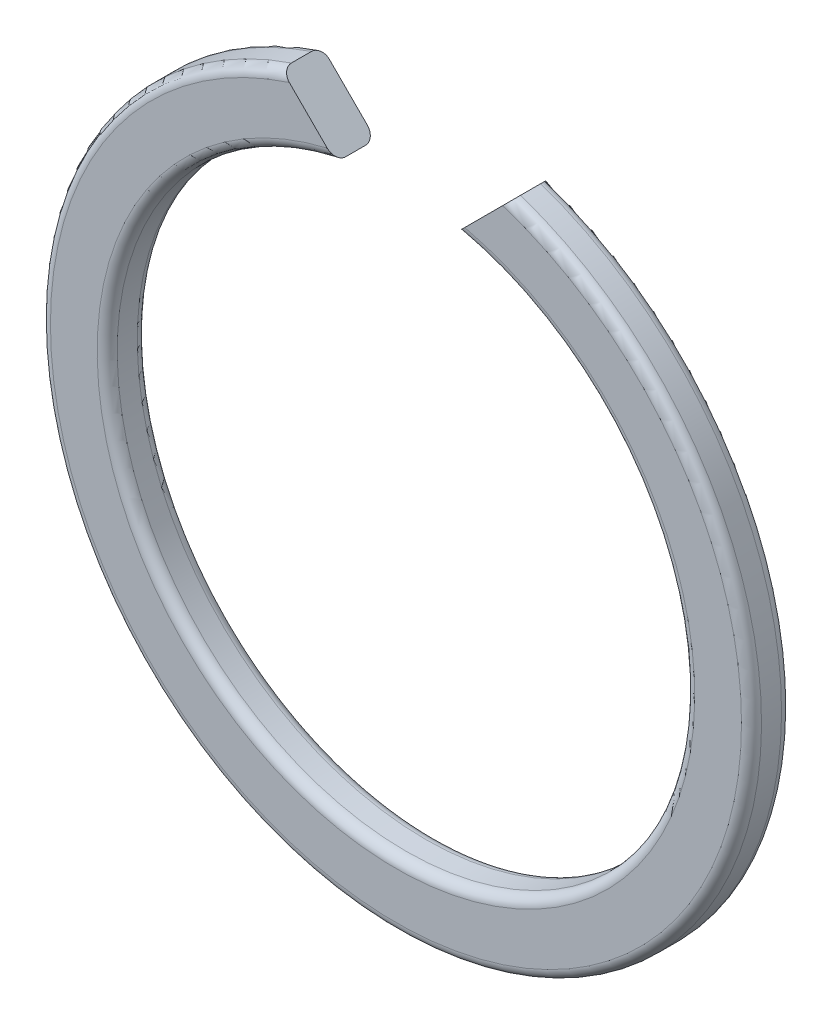
from build123d import *

# Parameters (mm, degrees)
BODYSKE_R      = 10.65
BODYSKE_R_2    = 8.65
BASEBODY_DEPTH = 1.2
SLIT_DEPTH     = 16.109103216
FILLET1_R      = 0.3


with BuildPart() as part:
    # BodySke → BaseBody (new body)
    with BuildSketch(Plane.XY):
        Circle(BODYSKE_R)
        Circle(BODYSKE_R_2, mode=Mode.SUBTRACT)
    extrude(amount=BASEBODY_DEPTH)

    # SlitSke → Slit (cut, through all)
    with BuildSketch(Plane.XY):
        Polygon((0, 6.65), (4, 10.65), (-4, 10.65), align=None)
    extrude(amount=SLIT_DEPTH, mode=Mode.SUBTRACT)

    # Fillet1
    fillet1_edges = [part.edges().sort_by_distance(p)[0] for p in [
        (0, -8.65, 0),
        (0, -10.65, 0),
        (0, -10.65, 1.2),
        (0, -8.65, 1.2),
    ]]
    fillet(fillet1_edges, radius=FILLET1_R)


solid = part.part
